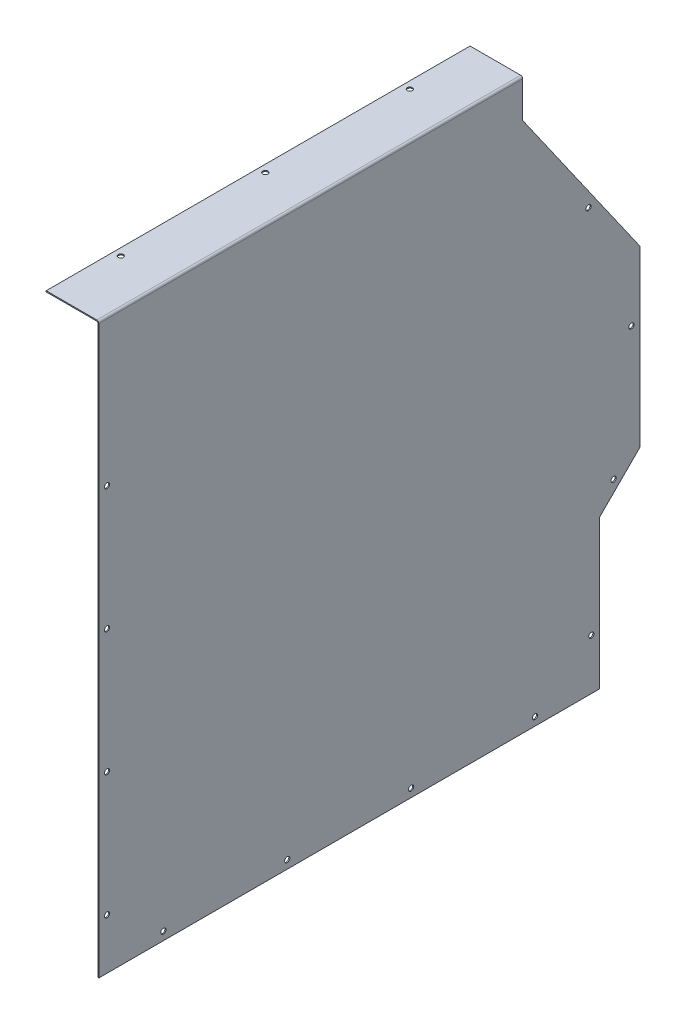
from build123d import *

# Parameters (mm, degrees)
EXTRUDE_1_DEPTH                  = 1
SM_EDGE_FLANGE_1_STRIP_W         = 6
SM_EDGE_FLANGE_1_STRIP_H         = 1
SM_EDGE_FLANGE_1_STRIP_CUT_DEPTH = 410.56637881
SM_EDGE_FLANGE_1_DEPTH           = 410.56637881
CUT_EXTRUDE_1_REACH              = 385.463
SKETCH_12_R                      = 2.5
CUT_EXTRUDE_2_REACH              = 614.164
SKETCH_13_R                      = 2.5


# Sheet-metal steps are written as plain solids
with BuildPart() as part:
    # Sketch 1 → Бобышка-Вытянуть1 (new body)
    with BuildSketch(Plane(origin=(0, 0, 0), x_dir=(0, 0, -1), z_dir=(1, 0, 0))):
        Polygon((223, -275.5), (223, -131.5), (262, -92.5), (262, 76.5), (148.56637881, 238.5), (148.56637881, 275.5), (-262, 275.5), (-262, -275.5), align=None)
    extrude(amount=EXTRUDE_1_DEPTH)

    # Ребро-кромка1 strip (across the edge) → Ребро-кромка1 strip cut (cut)
    with BuildSketch(Plane(origin=(0, 275.5, 262), x_dir=(0, -1, 0), z_dir=(0, 0, -1))):
        with Locations((-1, -0.5)):
            Rectangle(SM_EDGE_FLANGE_1_STRIP_W, SM_EDGE_FLANGE_1_STRIP_H)
    extrude(amount=SM_EDGE_FLANGE_1_STRIP_CUT_DEPTH, mode=Mode.SUBTRACT)

    # Ребро-кромка1 section (across the edge) → Ребро-кромка1 (add)
    with BuildSketch(Plane(origin=(0, 275.5, 262), x_dir=(0, -1, 0), z_dir=(0, 0, -1))):
        with BuildLine():
            Line((0, 1), (0, 50))
            Line((0, 50), (1, 50))
            Line((1, 50), (1, 1))
            ThreePointArc((1, 1), (1.292893219, 0.292893219), (2, 0))
            Line((2, 0), (2, -1))
            ThreePointArc((2, -1), (0.585786438, -0.414213562), (0, 1))
        make_face()
    extrude(amount=SM_EDGE_FLANGE_1_DEPTH)

    # Эскиз12 → Вырез-Вытянуть1 (cut, up to next)
    with BuildSketch(Plane.ZY, mode=Mode.PRIVATE) as cut_extrude_1_sk1:
        with Locations((254, 133.5)):
            Circle(SKETCH_12_R)
    cut_extrude_1_tool1 = extrude(cut_extrude_1_sk1.sketch, amount=-CUT_EXTRUDE_1_REACH, mode=Mode.PRIVATE) & part.part
    # Эскиз12 → Вырез-Вытянуть1 (cut, up to next)
    with BuildSketch(Plane.ZY, mode=Mode.PRIVATE) as cut_extrude_1_sk2:
        with Locations((254, 13.5)):
            Circle(SKETCH_12_R)
    cut_extrude_1_tool2 = extrude(cut_extrude_1_sk2.sketch, amount=-CUT_EXTRUDE_1_REACH, mode=Mode.PRIVATE) & part.part
    # Эскиз12 → Вырез-Вытянуть1 (cut, up to next)
    with BuildSketch(Plane.ZY, mode=Mode.PRIVATE) as cut_extrude_1_sk3:
        with Locations((254, -106.5)):
            Circle(SKETCH_12_R)
    cut_extrude_1_tool3 = extrude(cut_extrude_1_sk3.sketch, amount=-CUT_EXTRUDE_1_REACH, mode=Mode.PRIVATE) & part.part
    # Эскиз12 → Вырез-Вытянуть1 (cut, up to next)
    with BuildSketch(Plane.ZY, mode=Mode.PRIVATE) as cut_extrude_1_sk4:
        with Locations((254, -226.5)):
            Circle(SKETCH_12_R)
    cut_extrude_1_tool4 = extrude(cut_extrude_1_sk4.sketch, amount=-CUT_EXTRUDE_1_REACH, mode=Mode.PRIVATE) & part.part
    # Эскиз12 → Вырез-Вытянуть1 (cut, up to next)
    with BuildSketch(Plane.ZY, mode=Mode.PRIVATE) as cut_extrude_1_sk5:
        with Locations((199.5, -267.5)):
            Circle(SKETCH_12_R)
    cut_extrude_1_tool5 = extrude(cut_extrude_1_sk5.sketch, amount=-CUT_EXTRUDE_1_REACH, mode=Mode.PRIVATE) & part.part
    # Эскиз12 → Вырез-Вытянуть1 (cut, up to next)
    with BuildSketch(Plane.ZY, mode=Mode.PRIVATE) as cut_extrude_1_sk6:
        with Locations((79.5, -267.5)):
            Circle(SKETCH_12_R)
    cut_extrude_1_tool6 = extrude(cut_extrude_1_sk6.sketch, amount=-CUT_EXTRUDE_1_REACH, mode=Mode.PRIVATE) & part.part
    # Эскиз12 → Вырез-Вытянуть1 (cut, up to next)
    with BuildSketch(Plane.ZY, mode=Mode.PRIVATE) as cut_extrude_1_sk7:
        with Locations((-40.5, -267.5)):
            Circle(SKETCH_12_R)
    cut_extrude_1_tool7 = extrude(cut_extrude_1_sk7.sketch, amount=-CUT_EXTRUDE_1_REACH, mode=Mode.PRIVATE) & part.part
    # Эскиз12 → Вырез-Вытянуть1 (cut, up to next)
    with BuildSketch(Plane.ZY, mode=Mode.PRIVATE) as cut_extrude_1_sk8:
        with Locations((-160.5, -267.5)):
            Circle(SKETCH_12_R)
    cut_extrude_1_tool8 = extrude(cut_extrude_1_sk8.sketch, amount=-CUT_EXTRUDE_1_REACH, mode=Mode.PRIVATE) & part.part
    # Эскиз12 → Вырез-Вытянуть1 (cut, up to next)
    with BuildSketch(Plane.ZY, mode=Mode.PRIVATE) as cut_extrude_1_sk9:
        with Locations((-215, -226.5)):
            Circle(SKETCH_12_R)
    cut_extrude_1_tool9 = extrude(cut_extrude_1_sk9.sketch, amount=-CUT_EXTRUDE_1_REACH, mode=Mode.PRIVATE) & part.part
    # Эскиз12 → Вырез-Вытянуть1 (cut, up to next)
    with BuildSketch(Plane.ZY, mode=Mode.PRIVATE) as cut_extrude_1_sk10:
        with Locations((-236.686291501, -106.5)):
            Circle(SKETCH_12_R)
    cut_extrude_1_tool10 = extrude(cut_extrude_1_sk10.sketch, amount=-CUT_EXTRUDE_1_REACH, mode=Mode.PRIVATE) & part.part
    # Эскиз12 → Вырез-Вытянуть1 (cut, up to next)
    with BuildSketch(Plane.ZY, mode=Mode.PRIVATE) as cut_extrude_1_sk11:
        with Locations((-253.890872965, 13.5)):
            Circle(SKETCH_12_R)
    cut_extrude_1_tool11 = extrude(cut_extrude_1_sk11.sketch, amount=-CUT_EXTRUDE_1_REACH, mode=Mode.PRIVATE) & part.part
    # Эскиз12 → Вырез-Вытянуть1 (cut, up to next)
    with BuildSketch(Plane.ZY, mode=Mode.PRIVATE) as cut_extrude_1_sk12:
        with Locations((-212.321973612, 133.5)):
            Circle(SKETCH_12_R)
    cut_extrude_1_tool12 = extrude(cut_extrude_1_sk12.sketch, amount=-CUT_EXTRUDE_1_REACH, mode=Mode.PRIVATE) & part.part
    add(cut_extrude_1_tool1.solids().sort_by_distance((0, 133.5, 254))[0], mode=Mode.SUBTRACT)
    add(cut_extrude_1_tool2.solids().sort_by_distance((0, 13.5, 254))[0], mode=Mode.SUBTRACT)
    add(cut_extrude_1_tool3.solids().sort_by_distance((0, -106.5, 254))[0], mode=Mode.SUBTRACT)
    add(cut_extrude_1_tool4.solids().sort_by_distance((0, -226.5, 254))[0], mode=Mode.SUBTRACT)
    add(cut_extrude_1_tool5.solids().sort_by_distance((0, -267.5, 199.5))[0], mode=Mode.SUBTRACT)
    add(cut_extrude_1_tool6.solids().sort_by_distance((0, -267.5, 79.5))[0], mode=Mode.SUBTRACT)
    add(cut_extrude_1_tool7.solids().sort_by_distance((0, -267.5, -40.5))[0], mode=Mode.SUBTRACT)
    add(cut_extrude_1_tool8.solids().sort_by_distance((0, -267.5, -160.5))[0], mode=Mode.SUBTRACT)
    add(cut_extrude_1_tool9.solids().sort_by_distance((0, -226.5, -215))[0], mode=Mode.SUBTRACT)
    add(cut_extrude_1_tool10.solids().sort_by_distance((0, -106.5, -236.686292))[0], mode=Mode.SUBTRACT)
    add(cut_extrude_1_tool11.solids().sort_by_distance((0, 13.5, -253.890873))[0], mode=Mode.SUBTRACT)
    add(cut_extrude_1_tool12.solids().sort_by_distance((0, 133.5, -212.321974))[0], mode=Mode.SUBTRACT)

    # Эскиз13 → Вырез-Вытянуть2 (cut, up to next)
    with BuildSketch(Plane(origin=(0, 275.5, 0), x_dir=(1, 0, 0), z_dir=(0, 1, 0)), mode=Mode.PRIVATE) as cut_extrude_2_sk1:
        with Locations(Location((-43, -196.716810595, 0), (0, 0, 180))):
            Circle(SKETCH_13_R)
    cut_extrude_2_tool1 = extrude(cut_extrude_2_sk1.sketch, amount=-CUT_EXTRUDE_2_REACH, mode=Mode.PRIVATE) & part.part
    # Эскиз13 → Вырез-Вытянуть2 (cut, up to next)
    with BuildSketch(Plane(origin=(0, 275.5, 0), x_dir=(1, 0, 0), z_dir=(0, 1, 0)), mode=Mode.PRIVATE) as cut_extrude_2_sk2:
        with Locations(Location((-43, -56.716810595, 0), (0, 0, 180))):
            Circle(SKETCH_13_R)
    cut_extrude_2_tool2 = extrude(cut_extrude_2_sk2.sketch, amount=-CUT_EXTRUDE_2_REACH, mode=Mode.PRIVATE) & part.part
    # Эскиз13 → Вырез-Вытянуть2 (cut, up to next)
    with BuildSketch(Plane(origin=(0, 275.5, 0), x_dir=(1, 0, 0), z_dir=(0, 1, 0)), mode=Mode.PRIVATE) as cut_extrude_2_sk3:
        with Locations(Location((-43, 83.283189405, 0), (0, 0, 180))):
            Circle(SKETCH_13_R)
    cut_extrude_2_tool3 = extrude(cut_extrude_2_sk3.sketch, amount=-CUT_EXTRUDE_2_REACH, mode=Mode.PRIVATE) & part.part
    add(cut_extrude_2_tool1.solids().sort_by_distance((-43, 275.5, 196.716811))[0], mode=Mode.SUBTRACT)
    add(cut_extrude_2_tool2.solids().sort_by_distance((-43, 275.5, 56.716811))[0], mode=Mode.SUBTRACT)
    add(cut_extrude_2_tool3.solids().sort_by_distance((-43, 275.5, -83.283189))[0], mode=Mode.SUBTRACT)


solid = part.part
